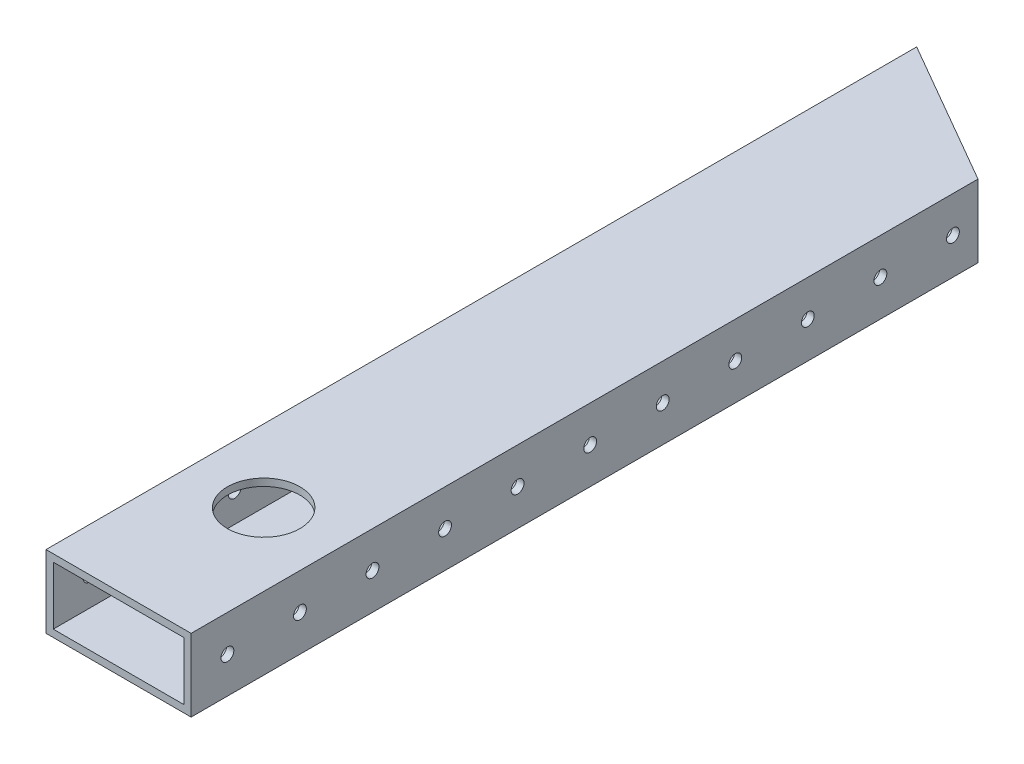
from build123d import *

# Parameters (mm, degrees)
SKETCH1_W               = 50.8
SKETCH1_H               = 25.4
SKETCH1_W_2             = 45.72
SKETCH1_H_2             = 20.32
BOSS_EXTRUDE1_DEPTH     = 355.6
F_8_CLEARANCE_HOLE1_D   = 4.4958
F_1_1_DIAMETER_HOLE1_D  = 25.4
CUT_EXTRUDE1_DEPTH      = 421.64
CUT_EXTRUDE1_DEPTH_BACK = 71.882
SKETCH8_W               = 50.8
SKETCH8_H               = 50.8
CUT_EXTRUDE6_DEPTH      = 494.792


with BuildPart() as part:
    # Sketch1 → Boss-Extrude1 (new body)
    with BuildSketch(Plane.XY):
        Rectangle(SKETCH1_W, SKETCH1_H)
        Rectangle(SKETCH1_W_2, SKETCH1_H_2, mode=Mode.SUBTRACT)
    extrude(amount=-BOSS_EXTRUDE1_DEPTH)

    # #8 Clearance Hole1 (through all)
    with Locations(Plane(origin=(25.4, 0, 0), x_dir=(0, 0, -1), z_dir=(1, 0, 0))):
        with Locations((12.7, 0), (38.1, 0), (63.5, 0), (88.9, 0), (114.3, 0), (139.7, 0), (165.1, 0), (190.5, 0), (215.9, 0), (241.3, 0), (266.7, 0), (292.1, 0), (317.5, 0), (342.9, 0)):
            Hole(F_8_CLEARANCE_HOLE1_D / 2)

    # 1 (1) Diameter Hole1 (through all)
    with Locations(Plane(origin=(0, 12.7, 0), x_dir=(1, 0, 0), z_dir=(0, 1, 0))):
        with Locations((0, 101.6)):
            Hole(F_1_1_DIAMETER_HOLE1_D / 2)

    # Sketch8 → Cut-Extrude1 (cut, two sides: drawn at the far end of the back side and taken through both)
    with BuildSketch(Plane(origin=(0, 12.7, 0), x_dir=(1, 0, 0), z_dir=(0, 1, 0)).offset(-CUT_EXTRUDE1_DEPTH_BACK)):
        with Locations((0, 25.4)):
            Rectangle(SKETCH8_W, SKETCH8_H)
    extrude(amount=CUT_EXTRUDE1_DEPTH + CUT_EXTRUDE1_DEPTH_BACK, mode=Mode.SUBTRACT)

    # Sketch12 → Cut-Extrude6 (cut)
    with BuildSketch(Plane.XZ.offset(12.7)):
        Polygon((-25.4, -355.6), (25.4, -326.270606325), (25.4, -355.6), align=None)
    extrude(amount=-CUT_EXTRUDE6_DEPTH, mode=Mode.SUBTRACT)


solid = part.part
